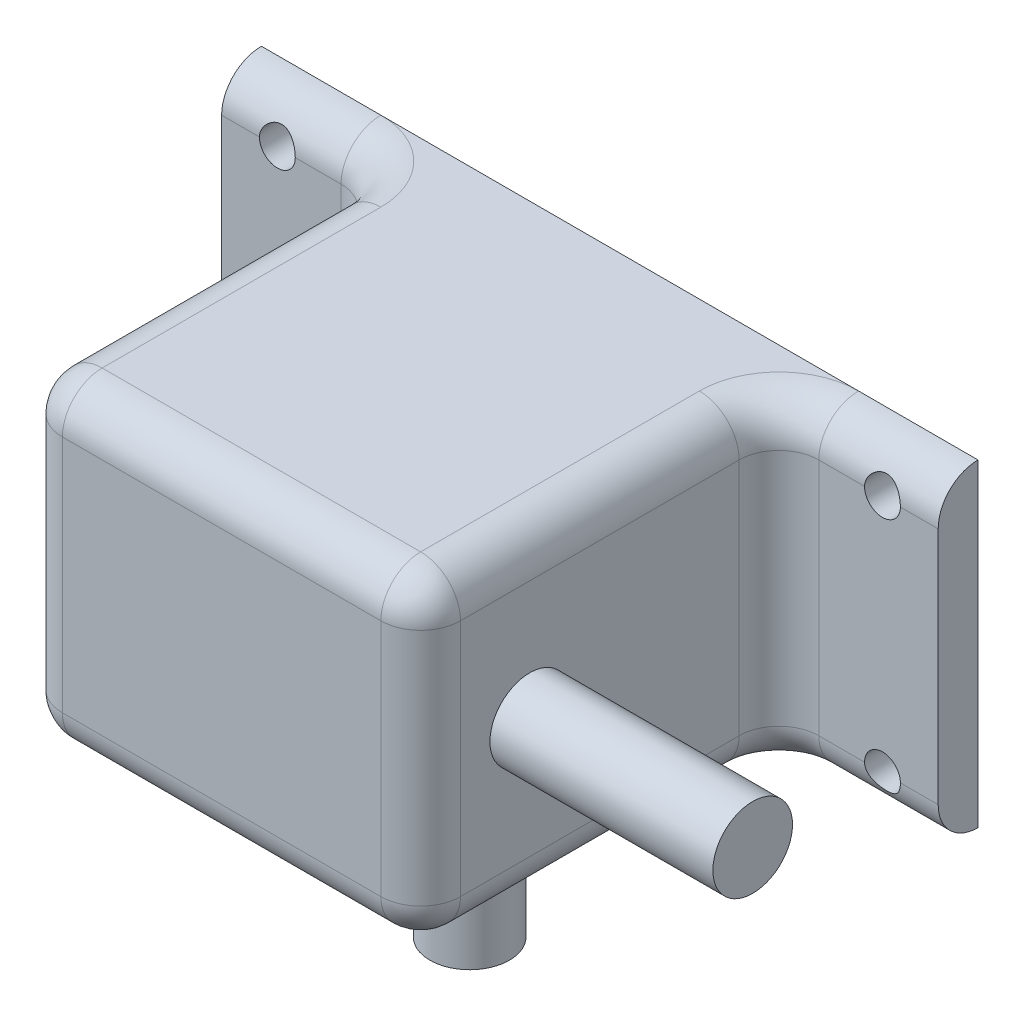
from build123d import *

# Parameters (mm, degrees)
SKETCH1_W                  = 90
SKETCH1_H                  = 50
BOSS_EXTRUDE1_DEPTH        = 40
SKETCH2_W                  = 20
SKETCH2_H                  = 45
CUT_EXTRUDE1_DEPTH         = 72.689445415
SKETCH3_W                  = 20
SKETCH3_H                  = 45
CUT_EXTRUDE2_DEPTH         = 72.689445415
F_4_5_4_5_DIAMETER_HOLE1_D = 4.5
FILLET1_R                  = 5
SCALE1_SCALE               = 2.8
SKETCH12_R                 = 14
BOSS_EXTRUDE2_DEPTH        = 70
SKETCH13_R                 = 14
BOSS_EXTRUDE3_DEPTH        = 78.4


with BuildPart() as part:
    # Sketch1 → Boss-Extrude1 (new body)
    with BuildSketch(Plane.XZ.offset(40)):
        with Locations((0, 13.914991763)):
            Rectangle(SKETCH1_W, SKETCH1_H)
    extrude(amount=-BOSS_EXTRUDE1_DEPTH)

    # Sketch2 → Cut-Extrude1 (cut, through all)
    with BuildSketch(Plane(origin=(0, 0, 0), x_dir=(-1, 0, 0), z_dir=(0, 1, 0))):
        with Locations((35, 16.414991763)):
            Rectangle(SKETCH2_W, SKETCH2_H)
    extrude(amount=-CUT_EXTRUDE1_DEPTH, mode=Mode.SUBTRACT)

    # Sketch3 → Cut-Extrude2 (cut, through all)
    with BuildSketch(Plane(origin=(0, 0, 0), x_dir=(-1, 0, 0), z_dir=(0, 1, 0))):
        with Locations((-35, 16.414991763)):
            Rectangle(SKETCH3_W, SKETCH3_H)
    extrude(amount=-CUT_EXTRUDE2_DEPTH, mode=Mode.SUBTRACT)

    # Ø4.5 (4.5) Diameter Hole1 (through all)
    with Locations(Plane.XY.offset(-6.085008237)):
        with Locations((38, -5), (-38, -35), (-38, -5), (38, -35)):
            Hole(F_4_5_4_5_DIAMETER_HOLE1_D / 2)

    # Fillet1
    # the kernel refuses this fillet: 5 mm, written as the material it adds along each edge
    with BuildSketch(Plane(origin=(-25, 0, -6.085008237), x_dir=(0, 0, 1), z_dir=(0, -1, 0))) as fillet1_piece_1:
        with BuildLine():
            CenterArc((FILLET1_R, FILLET1_R), FILLET1_R, 180, 90)
            Line((0, FILLET1_R), (0, 0))
            Line((0, 0), (FILLET1_R, 0))
        make_face()
    extrude(amount=40)
    with BuildSketch(Plane(origin=(25, 0, -6.085008237), x_dir=(0, 0, 1), z_dir=(0, -1, 0))) as fillet1_piece_2:
        with BuildLine():
            CenterArc((FILLET1_R, -FILLET1_R), FILLET1_R, 90, 90)
            Line((0, -FILLET1_R), (0, 0))
            Line((0, 0), (FILLET1_R, 0))
        make_face()
    extrude(amount=40)
    # the kernel refuses this fillet: 5 mm, written as the material it takes off along each edge
    with BuildSketch(Plane(origin=(-25, 12.5, 38.914991763), x_dir=(1, 0, 0), z_dir=(0, -1, 0))) as fillet1_2_piece_1:
        with BuildLine():
            CenterArc((FILLET1_R, -FILLET1_R), FILLET1_R, 90, 90)
            Line((0, -FILLET1_R), (0, 0))
            Line((0, 0), (FILLET1_R, 0))
        make_face()
    extrude(amount=65, mode=Mode.SUBTRACT)
    with BuildSketch(Plane(origin=(37.5, 0, 38.914991763), x_dir=(0, -1, 0), z_dir=(-1, 0, 0))) as fillet1_2_piece_2:
        with BuildLine():
            CenterArc((FILLET1_R, -FILLET1_R), FILLET1_R, 90, 90)
            Line((0, -FILLET1_R), (0, 0))
            Line((0, 0), (FILLET1_R, 0))
        make_face()
    extrude(amount=75, mode=Mode.SUBTRACT)
    with BuildSketch(Plane(origin=(37.5, -40, 38.914991763), x_dir=(0, 1, 0), z_dir=(-1, 0, 0))) as fillet1_2_piece_3:
        with BuildLine():
            CenterArc((FILLET1_R, FILLET1_R), FILLET1_R, 180, 90)
            Line((0, FILLET1_R), (0, 0))
            Line((0, 0), (FILLET1_R, 0))
        make_face()
    extrude(amount=75, mode=Mode.SUBTRACT)
    with BuildSketch(Plane(origin=(25, 12.5, 38.914991763), x_dir=(-1, 0, 0), z_dir=(0, -1, 0))) as fillet1_2_piece_4:
        with BuildLine():
            CenterArc((FILLET1_R, FILLET1_R), FILLET1_R, 180, 90)
            Line((0, FILLET1_R), (0, 0))
            Line((0, 0), (FILLET1_R, 0))
        make_face()
    extrude(amount=65, mode=Mode.SUBTRACT)
    # the kernel refuses this fillet: 5 mm, written as the material it takes off along each edge
    with BuildSketch(Plane(origin=(20, -35, 33.914991763), x_dir=(1, 0, 0), z_dir=(0, -1, 0))) as fillet1_3_piece_1_section:
        Polygon((0, 0), (FILLET1_R, 0), (FILLET1_R, FILLET1_R), (0, FILLET1_R), align=None)
    fillet1_3_piece_1 = extrude(amount=FILLET1_R, mode=Mode.PRIVATE)
    fillet1_3_piece_1 = fillet1_3_piece_1 - Plane(origin=(20, -35, 33.914991763), x_dir=(-0.7071067811865475, 0, -0.7071067811865475), z_dir=(0, -1, 0)) * Sphere(FILLET1_R, mode=Mode.PRIVATE)
    add(fillet1_3_piece_1, mode=Mode.SUBTRACT)
    with BuildSketch(Plane(origin=(-20, -35, 33.914991763), x_dir=(-1, 0, 0), z_dir=(0, -1, 0))) as fillet1_3_piece_2_section:
        Polygon((0, 0), (FILLET1_R, 0), (FILLET1_R, -FILLET1_R), (0, -FILLET1_R), align=None)
    fillet1_3_piece_2 = extrude(amount=FILLET1_R, mode=Mode.PRIVATE)
    fillet1_3_piece_2 = fillet1_3_piece_2 - Plane(origin=(-20, -35, 33.914991763), x_dir=(0.7071067811865476, 0, -0.7071067811865475), z_dir=(0, -1, 0)) * Sphere(FILLET1_R, mode=Mode.PRIVATE)
    add(fillet1_3_piece_2, mode=Mode.SUBTRACT)
    with BuildSketch(Plane(origin=(-20, -5, 33.914991763), x_dir=(0, 1, 0), z_dir=(-1, 0, 0))) as fillet1_3_piece_3_section:
        Polygon((0, 0), (FILLET1_R, 0), (FILLET1_R, -FILLET1_R), (0, -FILLET1_R), align=None)
    fillet1_3_piece_3 = extrude(amount=FILLET1_R, mode=Mode.PRIVATE)
    fillet1_3_piece_3 = fillet1_3_piece_3 - Plane(origin=(-20, -5, 33.914991763), x_dir=(0, -0.7071067811865475, -0.7071067811865475), z_dir=(-1, 0, 0)) * Sphere(FILLET1_R, mode=Mode.PRIVATE)
    add(fillet1_3_piece_3, mode=Mode.SUBTRACT)
    with BuildSketch(Plane(origin=(20, -5, 33.914991763), x_dir=(1, 0, 0), z_dir=(0, 1, 0))) as fillet1_3_piece_4_section:
        Polygon((0, 0), (FILLET1_R, 0), (FILLET1_R, -FILLET1_R), (0, -FILLET1_R), align=None)
    fillet1_3_piece_4 = extrude(amount=FILLET1_R, mode=Mode.PRIVATE)
    fillet1_3_piece_4 = fillet1_3_piece_4 - Plane(origin=(20, -5, 33.914991763), x_dir=(-0.7071067811865475, 0, -0.7071067811865475), z_dir=(0, 1, 0)) * Sphere(FILLET1_R, mode=Mode.PRIVATE)
    add(fillet1_3_piece_4, mode=Mode.SUBTRACT)
    with BuildSketch(Plane(origin=(-57.5, -40, -6.085008237), x_dir=(0, 0, -1), z_dir=(1, 0, 0)), Plane(origin=(-30, 0, -6.085008237), x_dir=(0, 0, -1), z_dir=(-1, 0, 0)), Plane(origin=(57.5, 0, -6.085008237), x_dir=(0, 0, -1), z_dir=(-1, 0, 0)), Plane(origin=(30, -40, -6.085008237), x_dir=(0, 0, -1), z_dir=(1, 0, 0))) as fillet1_3_piece_5:
        with BuildLine():
            CenterArc((FILLET1_R, FILLET1_R), FILLET1_R, 180, 90)
            Line((0, FILLET1_R), (0, 0))
            Line((0, 0), (FILLET1_R, 0))
        make_face()
    extrude(amount=27.5, mode=Mode.SUBTRACT)
    with BuildSketch(Plane(origin=(25, 0, -1.085008237), x_dir=(-1, 0, 0), z_dir=(0, 0, 1)), Plane(origin=(-25, -40, -1.085008237), x_dir=(1, 0, 0), z_dir=(0, 0, 1)), Plane(origin=(25, -40, 33.914991763), x_dir=(-1, 0, 0), z_dir=(0, 0, -1))) as fillet1_3_piece_6:
        with BuildLine():
            CenterArc((FILLET1_R, FILLET1_R), FILLET1_R, 180, 90)
            Line((0, FILLET1_R), (0, 0))
            Line((0, 0), (FILLET1_R, 0))
        make_face()
    extrude(amount=35, mode=Mode.SUBTRACT)
    with BuildSketch(Plane(origin=(-25, 0, 33.914991763), x_dir=(0, -1, 0), z_dir=(0, 0, -1))) as fillet1_3_piece_7:
        with BuildLine():
            CenterArc((FILLET1_R, -FILLET1_R), FILLET1_R, 90, 90)
            Line((0, -FILLET1_R), (0, 0))
            Line((0, 0), (FILLET1_R, 0))
        make_face()
    extrude(amount=35, mode=Mode.SUBTRACT)
    with BuildSketch(Plane(origin=(30, -40, -1.085008237), x_dir=(-1, 0, 0), z_dir=(0, 0, 1))) as fillet1_3_piece_8:
        with BuildLine():
            CenterArc((5 + FILLET1_R, -FILLET1_R), FILLET1_R, 90, 90)
            Line((5, -FILLET1_R), (5, 0))
            Line((5, 0), (5 + FILLET1_R, 0))
        make_face()
    revolve(axis=Axis((30, -40, -1.085008237), (0, -1, 0)), revolution_arc=90, mode=Mode.SUBTRACT)
    with BuildSketch(Plane(origin=(-30, -40, -1.085008237), x_dir=(1, 0, 0), z_dir=(0, 0, 1))) as fillet1_3_piece_9:
        with BuildLine():
            CenterArc((5 + FILLET1_R, FILLET1_R), FILLET1_R, 180, 90)
            Line((5, FILLET1_R), (5, 0))
            Line((5, 0), (5 + FILLET1_R, 0))
        make_face()
    revolve(axis=Axis((-30, -40, -1.085008237), (0, 1, 0)), revolution_arc=90, mode=Mode.SUBTRACT)
    with BuildSketch(Plane(origin=(-30, 0, -1.085008237), x_dir=(1, 0, 0), z_dir=(0, 0, 1))) as fillet1_3_piece_10:
        with BuildLine():
            CenterArc((5 + FILLET1_R, -FILLET1_R), FILLET1_R, 90, 90)
            Line((5, -FILLET1_R), (5, 0))
            Line((5, 0), (5 + FILLET1_R, 0))
        make_face()
    revolve(axis=Axis((-30, 0, -1.085008237), (0, 1, 0)), revolution_arc=90, mode=Mode.SUBTRACT)
    with BuildSketch(Plane(origin=(30, 0, -1.085008237), x_dir=(-1, 0, 0), z_dir=(0, 0, 1))) as fillet1_3_piece_11:
        with BuildLine():
            CenterArc((5 + FILLET1_R, FILLET1_R), FILLET1_R, 180, 90)
            Line((5, FILLET1_R), (5, 0))
            Line((5, 0), (5 + FILLET1_R, 0))
        make_face()
    revolve(axis=Axis((30, 0, -1.085008237), (0, -1, 0)), revolution_arc=90, mode=Mode.SUBTRACT)


with BuildPart() as part_1:
    # Scale1: scaled about (-1e-09, -20.000000005, 12.066484994)
    add(part.part.scale(SCALE1_SCALE).moved(Location((2e-09, 36.000000009, -21.719672989))))

    # Sketch12 → Boss-Extrude2 (add)
    with BuildSketch(Plane.XZ.offset(76)):
        with Locations(Location((0, 0, 0), (0, 0, 270))):
            Circle(SKETCH12_R)
    extrude(amount=BOSS_EXTRUDE2_DEPTH)

    # Sketch13 → Boss-Extrude3 (add)
    with BuildSketch(Plane(origin=(70, 0, 0), x_dir=(0, 0, -1), z_dir=(1, 0, 0))):
        with Locations(Location((-48.876838431, -20, 0), (0, 0, 180))):
            Circle(SKETCH13_R)
    extrude(amount=BOSS_EXTRUDE3_DEPTH)


solid = part_1.part
